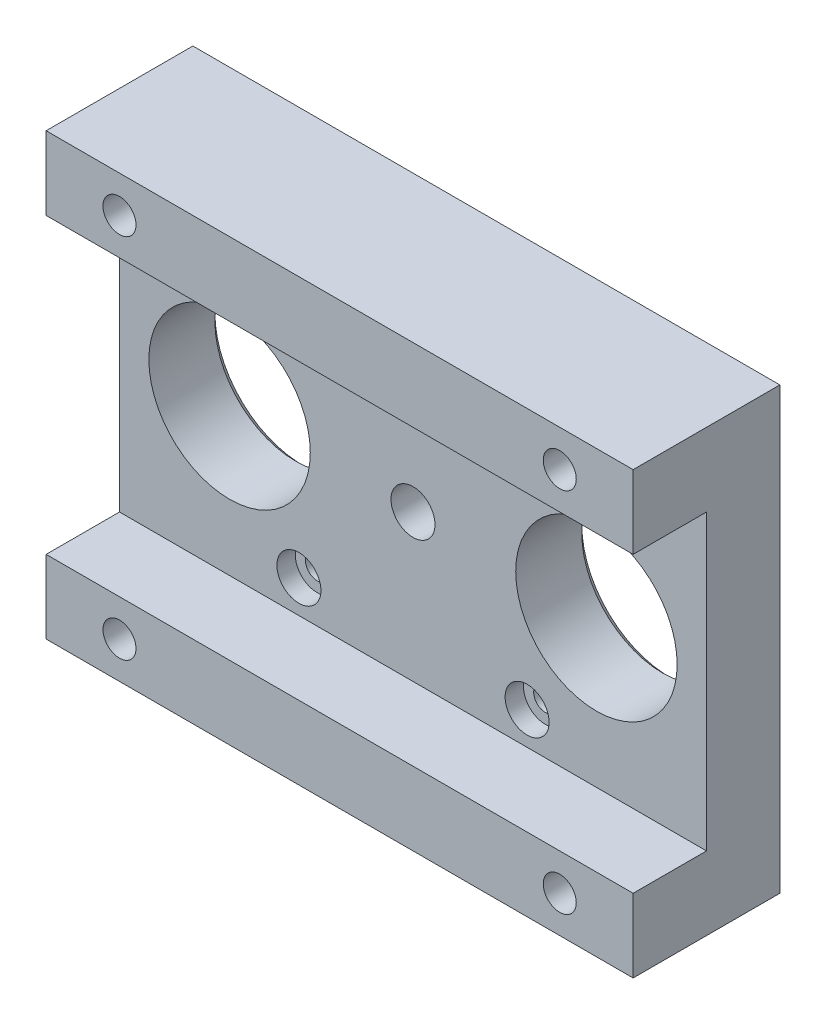
from build123d import *

# Parameters (mm, degrees)
SKIZZE1_W                       = 80
SKIZZE1_H                       = 60
AUFSATZ_LINEAR_AUSTRAGEN1_DEPTH = 10
SKIZZE2_W                       = 80
SKIZZE2_H                       = 10
AUFSATZ_LINEAR_AUSTRAGEN2_DEPTH = 10
SKIZZE3_R                       = 11.35
SCHNITT_LINEAR_AUSTRAGEN1_DEPTH = 2.2
SKIZZE4_R                       = 3
SCHNITT_LINEAR_AUSTRAGEN2_DEPTH = 12.2
SKIZZE5_R                       = 2.25
SCHNITT_LINEAR_AUSTRAGEN3_DEPTH = 12.2
SKIZZE6_R                       = 11
SCHNITT_LINEAR_AUSTRAGEN4_DEPTH = 12.2
SKIZZE7_R                       = 1.6
SCHNITT_LINEAR_AUSTRAGEN5_DEPTH = 12.2
SKIZZE8_R                       = 3
SCHNITT_LINEAR_AUSTRAGEN6_DEPTH = 2.5
FASE1_SIZE                      = 1


with BuildPart() as part:
    # Skizze1 → Aufsatz-Linear austragen1 (new body)
    with BuildSketch(Plane.XY):
        Rectangle(SKIZZE1_W, SKIZZE1_H)
    extrude(amount=AUFSATZ_LINEAR_AUSTRAGEN1_DEPTH)

    # Skizze2 → Aufsatz-Linear austragen2 (add)
    with BuildSketch(Plane.XY.offset(10)):
        with Locations((0, 25)):
            Rectangle(SKIZZE2_W, SKIZZE2_H)
        with Locations((0, -25)):
            Rectangle(SKIZZE2_W, SKIZZE2_H)
    extrude(amount=AUFSATZ_LINEAR_AUSTRAGEN2_DEPTH)

    # Skizze3 → Schnitt-Linear austragen1 (cut)
    with BuildSketch(Plane(origin=(0, 0, 0), x_dir=(-1, 0, 0), z_dir=(0, 0, -1))):
        Circle(SKIZZE3_R)
    extrude(amount=-SCHNITT_LINEAR_AUSTRAGEN1_DEPTH, mode=Mode.SUBTRACT)

    # Skizze4 → Schnitt-Linear austragen2 (cut)
    with BuildSketch(Plane(origin=(0, 0, 2.2), x_dir=(-1, 0, 0), z_dir=(0, 0, -1))):
        Circle(SKIZZE4_R)
    extrude(amount=-SCHNITT_LINEAR_AUSTRAGEN2_DEPTH, mode=Mode.SUBTRACT)

    # Skizze5 → Schnitt-Linear austragen3 (cut)
    with BuildSketch(Plane.XY.offset(20)):
        with Locations((30, 25)):
            Circle(SKIZZE5_R)
        with Locations((-30, 25)):
            Circle(SKIZZE5_R)
        with Locations((-30, -25)):
            Circle(SKIZZE5_R)
        with Locations((30, -25)):
            Circle(SKIZZE5_R)
    extrude(amount=-SCHNITT_LINEAR_AUSTRAGEN3_DEPTH, mode=Mode.SUBTRACT)

    # Skizze6 → Schnitt-Linear austragen4 (cut)
    with BuildSketch(Plane.XY.offset(10)):
        with Locations((-25, 0)):
            Circle(SKIZZE6_R)
        with Locations((25, 0)):
            Circle(SKIZZE6_R)
    extrude(amount=-SCHNITT_LINEAR_AUSTRAGEN4_DEPTH, mode=Mode.SUBTRACT)

    # Skizze7 → Schnitt-Linear austragen5 (cut)
    with BuildSketch(Plane.XY.offset(10)):
        with Locations((-15.55, 15.55)):
            Circle(SKIZZE7_R)
        with Locations((15.55, 15.55)):
            Circle(SKIZZE7_R)
        with Locations((15.55, -15.55)):
            Circle(SKIZZE7_R)
        with Locations((-15.55, -15.55)):
            Circle(SKIZZE7_R)
    extrude(amount=-SCHNITT_LINEAR_AUSTRAGEN5_DEPTH, mode=Mode.SUBTRACT)

    # Skizze8 → Schnitt-Linear austragen6 (cut)
    with BuildSketch(Plane.XY.offset(10)):
        with Locations((-15.55, 15.55)):
            Circle(SKIZZE8_R)
        with Locations((15.55, 15.55)):
            Circle(SKIZZE8_R)
        with Locations((-15.55, -15.55)):
            Circle(SKIZZE8_R)
        with Locations((15.55, -15.55)):
            Circle(SKIZZE8_R)
    extrude(amount=-SCHNITT_LINEAR_AUSTRAGEN6_DEPTH, mode=Mode.SUBTRACT)

    # Fase1
    fase1_edges = [part.edges().sort_by_distance(p)[0] for p in [
        (14, 0, 0),
        (-36, 0, 0),
    ]]
    chamfer(fase1_edges, length=FASE1_SIZE)


solid = part.part
